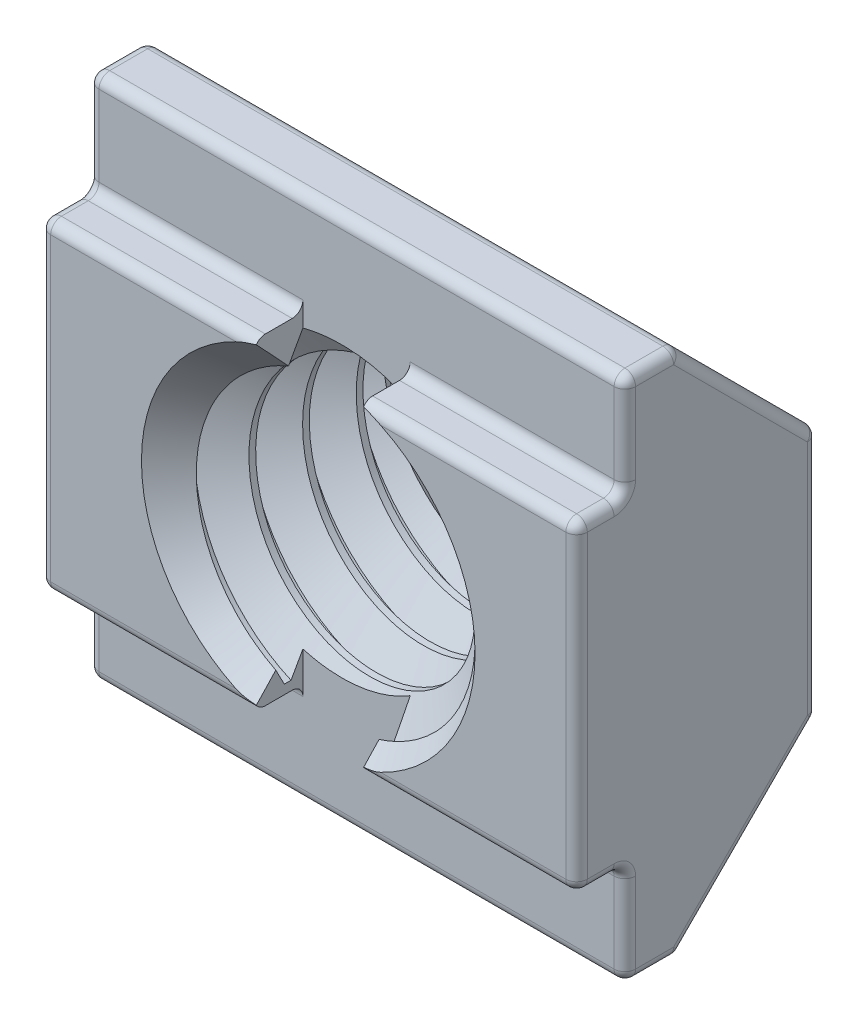
from build123d import *

# Parameters (mm, degrees)
BOSS_EXTRUDE1_DEPTH           = 5
BOSS_EXTRUDE1_DEPTH_BACK      = 5
FILLET4_R                     = 0.2
CUT_EXTRUDE11_REACH           = 10.322
SKETCH19_W                    = 2
SKETCH19_H                    = 9.8
SKETCH6_R                     = 3
CUT_EXTRUDE2_DEPTH            = 9.322259309
FILLET5_R                     = 0.2
SWEEP1_PITCH                  = 1
CUT_EXTRUDE12_DEPTH           = 9.922148153
CUT_EXTRUDE12_DEPTH_BACK      = 0.9
SKETCH20_W                    = 2
SKETCH20_H                    = 9.8
SKETCH17_R                    = 3.108253175
CUT_EXTRUDE9_OTHER_WAY_DEPTH  = 9.922148153
SKETCH18_R                    = 3.108253175
CUT_EXTRUDE10_OTHER_WAY_DEPTH = 9.322259363
CUT_EXTRUDE13_DEPTH           = 12.361007898


with BuildPart() as part:
    # Sketch3 → Boss-Extrude1 (new, two sides: drawn at the far end of the back side and taken through both)
    with BuildSketch(Plane(origin=(0, 0, 0), x_dir=(0, 0, -1), z_dir=(1, 0, 0)).offset(-BOSS_EXTRUDE1_DEPTH_BACK)):
        Polygon((-2.25, 3), (-1.35, 3), (-1.35, 4.9), (-0.36, 4.9), (2.25, 2.29), (2.25, -2.29), (-0.36, -4.9), (-1.35, -4.9), (-1.35, -3), (-2.25, -3), align=None)
    extrude(amount=BOSS_EXTRUDE1_DEPTH + BOSS_EXTRUDE1_DEPTH_BACK)

    # Fillet4
    fillet4_edges = [part.edges().sort_by_distance(p)[0] for p in [
        (0, 3, 2.25),
        (0, 3, 1.35),
        (0, 4.9, 1.35),
        (0, 4.9, 0.36),
        (0, 2.29, -2.25),
        (0, -2.29, -2.25),
        (0, -4.9, 0.36),
        (0, -4.9, 1.35),
        (0, -3, 1.35),
        (0, -3, 2.25),
    ]]
    fillet(fillet4_edges, radius=FILLET4_R)

    # Cut-Extrude11: up to this face of the body (flat: up to its plane)
    cut_extrude11_end = Plane(part.part.faces().sort_by_distance((0, 3.95, 1.35))[0])
    # Sketch19 → Cut-Extrude11 (cut, up to the picked face)
    with BuildSketch(Plane.XY.offset(2.25), mode=Mode.PRIVATE) as cut_extrude11_sk1:
        Rectangle(SKETCH19_W, SKETCH19_H)
    cut_extrude11_tool1 = split(extrude(cut_extrude11_sk1.sketch, amount=-CUT_EXTRUDE11_REACH, mode=Mode.PRIVATE), bisect_by=cut_extrude11_end, keep=Keep.BOTH, mode=Mode.PRIVATE)
    add(cut_extrude11_tool1.solids().sort_by(Axis((0, 0, 2.25), (0, 0, -1)))[0], mode=Mode.SUBTRACT)

    # Sketch6 → Cut-Extrude2 (cut, through all)
    with BuildSketch(Plane.XY.offset(2.25)):
        with Locations(Location((0, 0, 0), (0, 0, 47.368013735))):
            Circle(SKETCH6_R)
    extrude(amount=-CUT_EXTRUDE2_DEPTH, mode=Mode.SUBTRACT)

    # Fillet5
    fillet5_edges = [part.edges().sort_by_distance(p)[0] for p in [
        (5, 3, 1.8),
        (-5, 3, 1.8),
        (5, 0, 2.25),
        (5, -3, 1.8),
        (5, -3.95, 1.35),
        (5, -4.9, 0.796421356),
        (5, -3.595, -0.945),
        (5, 0, -2.25),
        (5, 3.595, -0.945),
        (5, 4.9, 0.796421356),
        (5, 3.95, 1.35),
        (5, 4.841421356, 1.291421356),
        (5, 4.884775907, 0.366306026),
        (5, 2.283693974, -2.234775907),
        (5, -2.283693974, -2.234775907),
        (5, -4.884775907, 0.366306026),
        (5, -4.841421356, 1.291421356),
        (5, -2.941421356, 2.191421356),
        (5, 2.941421356, 2.191421356),
        (-5, 0, 2.25),
        (-5, 3.95, 1.35),
        (-5, 4.9, 0.796421356),
        (-5, 3.595, -0.945),
        (-5, 0, -2.25),
        (-5, -3.595, -0.945),
        (-5, -4.9, 0.796421356),
        (-5, -3.95, 1.35),
        (-5, -3, 1.8),
        (-5, 4.841421356, 1.291421356),
        (-5, 4.884775907, 0.366306026),
        (-5, 2.283693974, -2.234775907),
        (-5, -2.283693974, -2.234775907),
        (-5, -4.884775907, 0.366306026),
        (-5, -4.841421356, 1.291421356),
        (-5, -2.941421356, 2.191421356),
        (-5, 2.941421356, 2.191421356),
        (5, -3.058578644, 1.408578644),
        (-5, -3.058578644, 1.408578644),
        (5, 3.058578644, 1.408578644),
        (-5, 3.058578644, 1.408578644),
    ]]
    fillet(fillet5_edges, radius=FILLET5_R)

    # Sweep1: the profile of Sketch11 screwed along a right-hand helix of 5.5 turns, 8 arcs to a turn; built about Z, then put on its axis
    sweep1_z = Axis((0, 0, 0), (0, 0, 1))
    sweep1_corners = [(2.350480947, 0, -0.5), (2.350480947, 0, -0.375), (3.054126588, 0, 0.03125), (3.054126588, 0, -0.90625)]
    with BuildLine(mode=Mode.PRIVATE) as sweep1_profile:
        Line(sweep1_corners[0], sweep1_corners[1])
        Line(sweep1_corners[1], sweep1_corners[2])
        Line(sweep1_corners[2], sweep1_corners[3])
        Line(sweep1_corners[3], sweep1_corners[0])
    sweep1_cap = Face(sweep1_profile.wire())
    sweep1_turn_angles = [0, 22.5, 45, 67.5, 90, 112.5, 135, 157.5, 180, 202.5, 225, 247.5, 270, 292.5, 315, 337.5, 360]
    sweep1_turn_weights = [1, 0.9238795325112867, 1, 0.9238795325112867, 1, 0.9238795325112867, 1, 0.9238795325112867, 1, 0.9238795325112867, 1, 0.9238795325112867, 1, 0.9238795325112867, 1, 0.9238795325112867, 1]
    sweep1_turn_rails = [Edge.make_bspline([Vector(p[0], p[1], 0).rotate(sweep1_z, sweep1_turn_angles[k]) / sweep1_turn_weights[k] + Vector(0, 0, p[2] + SWEEP1_PITCH * sweep1_turn_angles[k] / 360) for k in range(17)], [0, 0, 0, 1, 1, 2, 2, 3, 3, 4, 4, 5, 5, 6, 6, 7, 7, 8, 8, 8], 2, sweep1_turn_weights) for p in sweep1_corners]
    sweep1_turn_sides = [Face.make_surface_from_curves(sweep1_turn_rails[p[0]], sweep1_turn_rails[p[1]]) for p in [(0, 1), (1, 2), (2, 3), (3, 0)]]
    sweep1_last_angles = [1800, 1822.5, 1845, 1867.5, 1890, 1912.5, 1935, 1957.5, 1980]
    sweep1_last_weights = [1, 0.9238795325112867, 1, 0.9238795325112867, 1, 0.9238795325112867, 1, 0.9238795325112693, 1]
    sweep1_last_rails = [Edge.make_bspline([Vector(p[0], p[1], 0).rotate(sweep1_z, sweep1_last_angles[k]) / sweep1_last_weights[k] + Vector(0, 0, p[2] + SWEEP1_PITCH * sweep1_last_angles[k] / 360) for k in range(9)], [0, 0, 0, 1, 1, 2, 2, 3, 3, 4, 4, 4], 2, sweep1_last_weights) for p in sweep1_corners]
    sweep1_last_sides = [Face.make_surface_from_curves(sweep1_last_rails[p[0]], sweep1_last_rails[p[1]]) for p in [(0, 1), (1, 2), (2, 3), (3, 0)]]
    sweep1 = Plane(origin=(0, 0, 2.25), x_dir=(0, 1, 0), z_dir=(0, 0, -1)) * Solid(Shell([*[p.moved(Location((0, 0, SWEEP1_PITCH * i))) for i in range(5) for p in sweep1_turn_sides], *sweep1_last_sides, sweep1_cap, sweep1_cap.rotate(sweep1_z, 1980).moved(Location((0, 0, SWEEP1_PITCH * 1980 / 360)))]))
    add(sweep1)

    # Sketch20 → Cut-Extrude12 (cut, two sides: drawn at the far end of the back side and taken through both)
    with BuildSketch(Plane.XY.offset(2.25).offset(-CUT_EXTRUDE12_DEPTH_BACK)):
        Rectangle(SKETCH20_W, SKETCH20_H)
    extrude(amount=CUT_EXTRUDE12_DEPTH + CUT_EXTRUDE12_DEPTH_BACK, mode=Mode.SUBTRACT)

    # Cut-Extrude9 cone 1 section (through the dimple's axis) → Cut-Extrude9 (revolve, cut)
    with BuildSketch(Plane(origin=(0, 0, 2.25), x_dir=(0, -1, 0), z_dir=(1, 0, 0))):
        Polygon((0, 0), (3.108253175, 0), (0, 3.108253175), align=None)
    revolve(axis=Axis((0, 0, 2.25), (0, 0, -1)), mode=Mode.SUBTRACT)

    # Sketch17 → Cut-Extrude9 other way (cut)
    with BuildSketch(Plane.XY.offset(2.25)):
        Circle(SKETCH17_R)
    extrude(amount=CUT_EXTRUDE9_OTHER_WAY_DEPTH, mode=Mode.SUBTRACT)

    # Cut-Extrude10 cone 1 section (through the dimple's axis) → Cut-Extrude10 (revolve, cut)
    with BuildSketch(Plane(origin=(0, 0, -2.25), x_dir=(0, 1, 0), z_dir=(1, 0, 0))):
        Polygon((0, 0), (3.108253175, 0), (0, 3.108253175), align=None)
    revolve(axis=Axis((0, 0, -2.25), (0, 0, 1)), mode=Mode.SUBTRACT)

    # Sketch18 → Cut-Extrude10 other way (cut)
    with BuildSketch(Plane(origin=(0, 0, -2.25), x_dir=(-1, 0, 0), z_dir=(0, 0, -1))):
        Circle(SKETCH18_R)
    extrude(amount=CUT_EXTRUDE10_OTHER_WAY_DEPTH, mode=Mode.SUBTRACT)

    # Sketch21 → Cut-Extrude13 (cut, through all)
    with BuildSketch(Plane(origin=(5, 0, 0), x_dir=(0, 0, -1), z_dir=(1, 0, 0))):
        Polygon((-0.36, -4.9), (2.25, -4.9), (2.25, -2.29), align=None)
        Polygon((2.25, 2.29), (2.25, 4.9), (-0.36, 4.9), align=None)
    extrude(amount=-CUT_EXTRUDE13_DEPTH, mode=Mode.SUBTRACT)


solid = part.part
